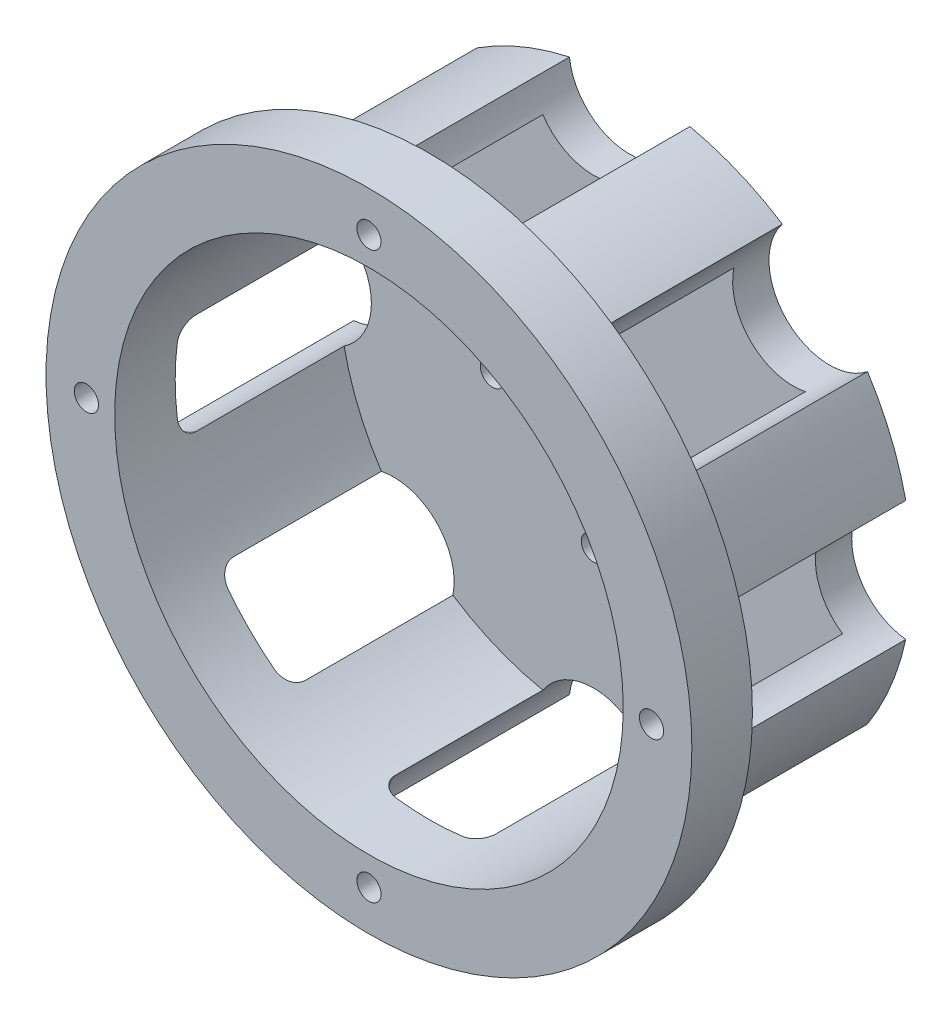
from build123d import *

# Parameters (mm, degrees)
SKETCH1_R           = 31.5
SKETCH1_R_2         = 1.5
SKETCH1_R_3         = 7
BOSS_EXTRUDE1_DEPTH = 4.5
SKETCH1_3_R         = 35
SKETCH1_3_R_2       = 31.5
BOSS_EXTRUDE2_DEPTH = 32.3
SKETCH2_R           = 7.5
CUT_EXTRUDE1_DEPTH  = 27.5
BOSS_EXTRUDE3_START = -7.5
SKETCH3_R           = 40
SKETCH3_R_2         = 31.5
BOSS_EXTRUDE3_DEPTH = 7.5
SKETCH4_R           = 1.5
CUT_EXTRUDE2_DEPTH  = 10
FILLET1_R           = 2


with BuildPart() as part:
    # Sketch1 → Boss-Extrude1 (new body)
    with BuildSketch(Plane.XY):
        Circle(SKETCH1_R)
        with Locations((0, 12.5)):
            Circle(SKETCH1_R_2, mode=Mode.SUBTRACT)
        with Locations((-12.5, 0)):
            Circle(SKETCH1_R_2, mode=Mode.SUBTRACT)
        with Locations((0, -12.5)):
            Circle(SKETCH1_R_2, mode=Mode.SUBTRACT)
        with Locations((12.5, 0)):
            Circle(SKETCH1_R_2, mode=Mode.SUBTRACT)
        Circle(SKETCH1_R_3, mode=Mode.SUBTRACT)
    extrude(amount=BOSS_EXTRUDE1_DEPTH)

    # Sketch1<3> → Boss-Extrude2 (add)
    with BuildSketch(Plane.XY):
        Circle(SKETCH1_3_R)
        Circle(SKETCH1_3_R_2, mode=Mode.SUBTRACT)
    extrude(amount=BOSS_EXTRUDE2_DEPTH)

    # Sketch2 → Cut-Extrude1 (cut)
    with BuildSketch(Plane(origin=(0, 0, 0), x_dir=(-1, 0, 0), z_dir=(0, 0, -1))):
        with Locations((0, 35)):
            Circle(SKETCH2_R)
        with Locations((24.748737342, 24.748737342)):
            Circle(SKETCH2_R)
        with Locations((35, 0)):
            Circle(SKETCH2_R)
        with Locations((24.748737342, -24.748737342)):
            Circle(SKETCH2_R)
        with Locations((0, -35)):
            Circle(SKETCH2_R)
        with Locations((-24.748737342, -24.748737342)):
            Circle(SKETCH2_R)
        with Locations((-35, 0)):
            Circle(SKETCH2_R)
        with Locations((-24.748737342, 24.748737342)):
            Circle(SKETCH2_R)
    extrude(amount=-CUT_EXTRUDE1_DEPTH, mode=Mode.SUBTRACT)

    # Sketch3 → Boss-Extrude3 (add)
    with BuildSketch(Plane.XY.offset(32.3).offset(BOSS_EXTRUDE3_START)):
        Circle(SKETCH3_R)
        Circle(SKETCH3_R_2, mode=Mode.SUBTRACT)
    extrude(amount=BOSS_EXTRUDE3_DEPTH)

    # Sketch4 → Cut-Extrude2 (cut)
    with BuildSketch(Plane.XY.offset(32.3)):
        with Locations((0, 35)):
            Circle(SKETCH4_R)
        with Locations((35, 0)):
            Circle(SKETCH4_R)
        with Locations((0, -35)):
            Circle(SKETCH4_R)
        with Locations((-35, 0)):
            Circle(SKETCH4_R)
    extrude(amount=-CUT_EXTRUDE2_DEPTH, mode=Mode.SUBTRACT)

    # Fillet1
    fillet1_edges = [part.edges().sort_by_distance(p)[0] for p in [
        (-32.462524689, -7.057706359, 24.8),
        (27.945023368, 17.963919316, 24.8),
        (-27.945023368, 17.963919316, 24.8),
        (-7.057706359, 32.462524689, 24.8),
        (17.963919316, 27.945023368, 24.8),
        (32.462524689, -7.057706359, 24.8),
        (32.462524689, 7.057706359, 24.8),
        (-17.963919316, -27.945023368, 24.8),
        (7.057706359, -32.462524689, 24.8),
        (27.945023368, -17.963919316, 24.8),
        (17.963919316, -27.945023368, 24.8),
        (-7.057706359, -32.462524689, 24.8),
        (-27.945023368, -17.963919316, 24.8),
        (-32.462524689, 7.057706359, 24.8),
        (-17.963919316, 27.945023368, 24.8),
        (7.057706359, 32.462524689, 24.8),
        (13.393920133, 32.335783638, 24.8),
        (32.335783638, 13.393920133, 24.8),
        (32.335783638, -13.393920133, 24.8),
        (13.393920133, -32.335783638, 24.8),
        (-13.393920133, -32.335783638, 24.8),
        (-32.335783638, -13.393920133, 24.8),
        (-32.335783638, 13.393920133, 24.8),
        (-13.393920133, 32.335783638, 24.8),
    ]]
    fillet(fillet1_edges, radius=FILLET1_R)


solid = part.part
